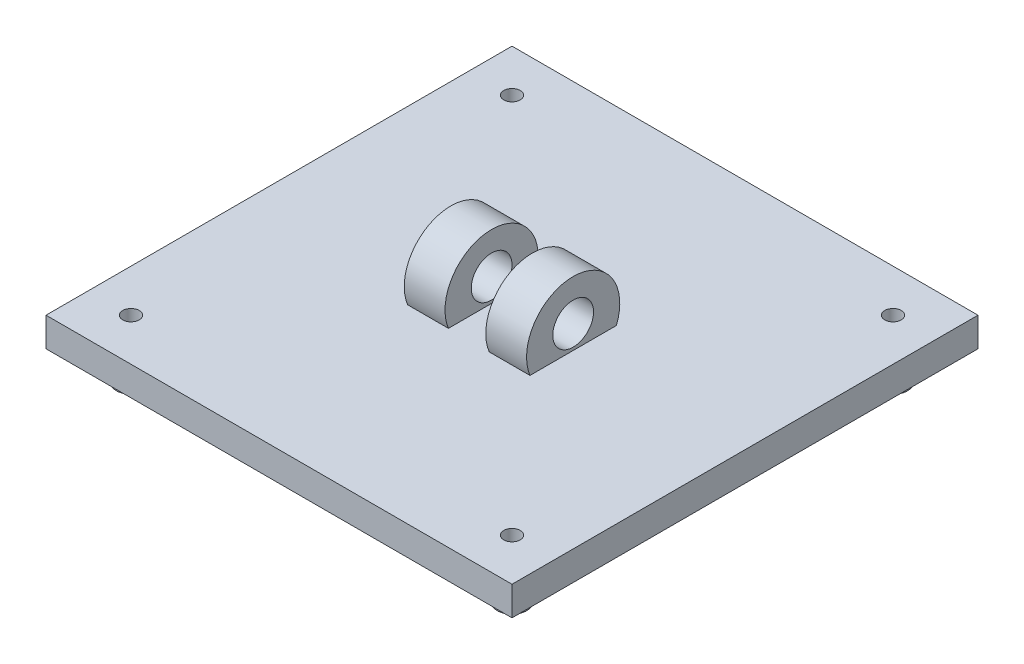
from build123d import *

# Parameters (mm, degrees)
SKETCH2_W           = 80
SKETCH2_H           = 80
BOSS_EXTRUDE1_DEPTH = 5
BOSS_EXTRUDE2_DEPTH = 10.5
CUT_EXTRUDE3_DEPTH  = 3.5
SKETCH8_R           = 3.5
CUT_EXTRUDE5_DEPTH  = 67.379590237
SKETCH9_R           = 2.5
BOSS_EXTRUDE3_DEPTH = 5
SKETCH10_R          = 1.41
CUT_EXTRUDE6_DEPTH  = 61.340699366


with BuildPart() as part:
    # Sketch2 → Boss-Extrude1 (new body)
    with BuildSketch(Plane(origin=(0, 0, 0), x_dir=(1, 0, 0), z_dir=(0, 1, 0))):
        Rectangle(SKETCH2_W, SKETCH2_H)
    extrude(amount=BOSS_EXTRUDE1_DEPTH)

    # Sketch3 → Boss-Extrude2 (add, symmetric)
    with BuildSketch(Plane(origin=(0, 0, 0), x_dir=(0, 0, -1), z_dir=(1, 0, 0))):
        with BuildLine():
            ThreePointArc((0, 0), (5.656854249, 2.343145751), (8, 8))
            ThreePointArc((8, 8), (-5.656854249, 13.656854249), (0, 0))
        make_face()
    extrude(amount=BOSS_EXTRUDE2_DEPTH, both=True)

    # Sketch4 → Cut-Extrude3 (cut, symmetric)
    with BuildSketch(Plane(origin=(0, 0, 0), x_dir=(0, 0, -1), z_dir=(1, 0, 0))):
        with BuildLine():
            ThreePointArc((8, 8), (-1.5281381, 15.85269342), (-7.416198487, 5))
            Line((-7.416198487, 5), (7.416198487, 5))
            ThreePointArc((7.416198487, 5), (7.85269342, 6.4718619), (8, 8))
        make_face()
    extrude(amount=CUT_EXTRUDE3_DEPTH, both=True, mode=Mode.SUBTRACT)

    # Sketch8 → Cut-Extrude5 (cut, through all)
    with BuildSketch(Plane(origin=(10.5, 0, 0), x_dir=(0, 0, -1), z_dir=(1, 0, 0))):
        with Locations((0, 9)):
            Circle(SKETCH8_R)
    extrude(amount=-CUT_EXTRUDE5_DEPTH, mode=Mode.SUBTRACT)

    # Sketch9 → Boss-Extrude3 (add)
    with BuildSketch(Plane.XZ):
        with Locations((-32.705, 32.705)):
            Circle(SKETCH9_R)
        with Locations((32.705, 32.705)):
            Circle(SKETCH9_R)
        with Locations((-32.705, -32.705)):
            Circle(SKETCH9_R)
        with Locations((32.705, -32.705)):
            Circle(SKETCH9_R)
    extrude(amount=BOSS_EXTRUDE3_DEPTH)

    # Sketch10 → Cut-Extrude6 (cut, through all)
    with BuildSketch(Plane.XZ.offset(5)):
        with Locations((-32.705, -32.705)):
            Circle(SKETCH10_R)
        with Locations((-32.705, 32.705)):
            Circle(SKETCH10_R)
        with Locations((32.705, 32.705)):
            Circle(SKETCH10_R)
        with Locations((32.705, -32.705)):
            Circle(SKETCH10_R)
    extrude(amount=-CUT_EXTRUDE6_DEPTH, mode=Mode.SUBTRACT)


solid = part.part
